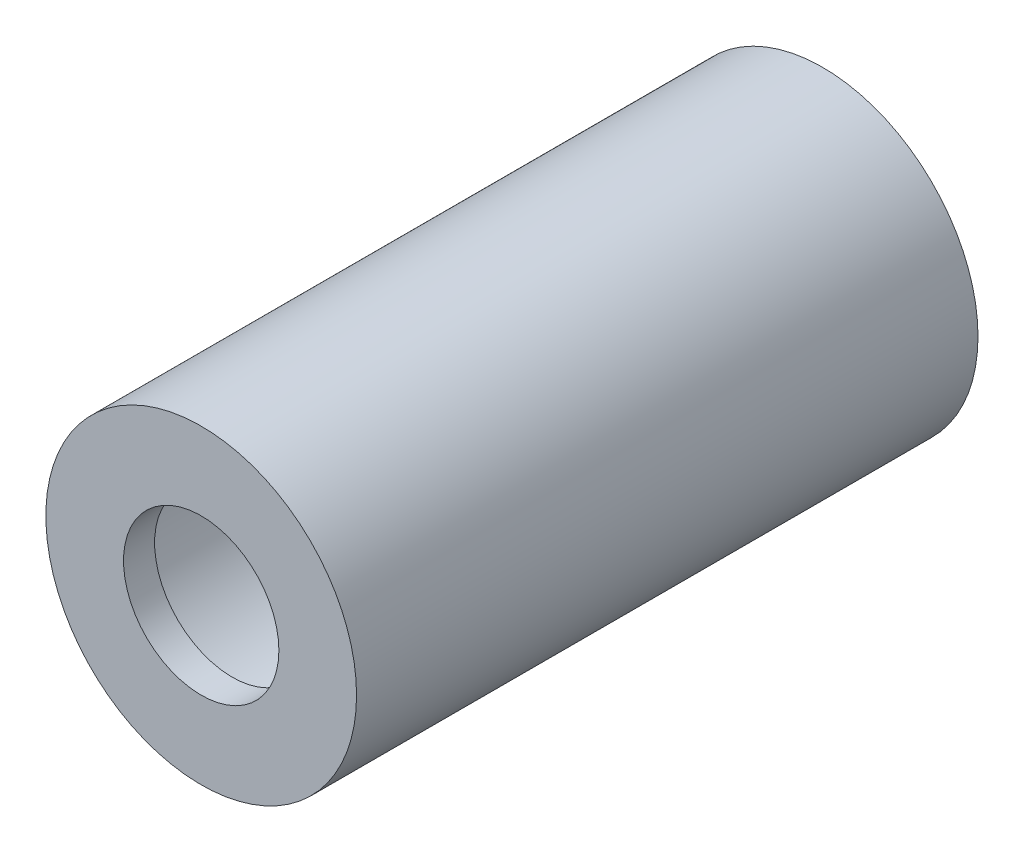
from build123d import *

# Parameters (mm, degrees)
SKETCH_2_R          = 2.5
CUT_EXTRUDE_1_DEPTH = 22.213203436


# Read off the part's stored shape, not the designer's step: 拉伸-薄壁1
with BuildPart() as part:
    # 拉伸-薄壁1 outline → 拉伸-薄壁1 (revolve)
    with BuildSketch(Plane.XZ):
        Polygon((5, 20), (0, 20), (0, 19), (4, 19), (4, 1), (0, 1), (0, 0), (5, 0), align=None)
    revolve(axis=Axis((0, 0, 0), (0, 0, 1)))

    # 草图2 → 切除-拉伸1 (cut, through all)
    with BuildSketch(Plane.XY.offset(20)):
        Circle(SKETCH_2_R)
    extrude(amount=-CUT_EXTRUDE_1_DEPTH, mode=Mode.SUBTRACT)


solid = part.part
